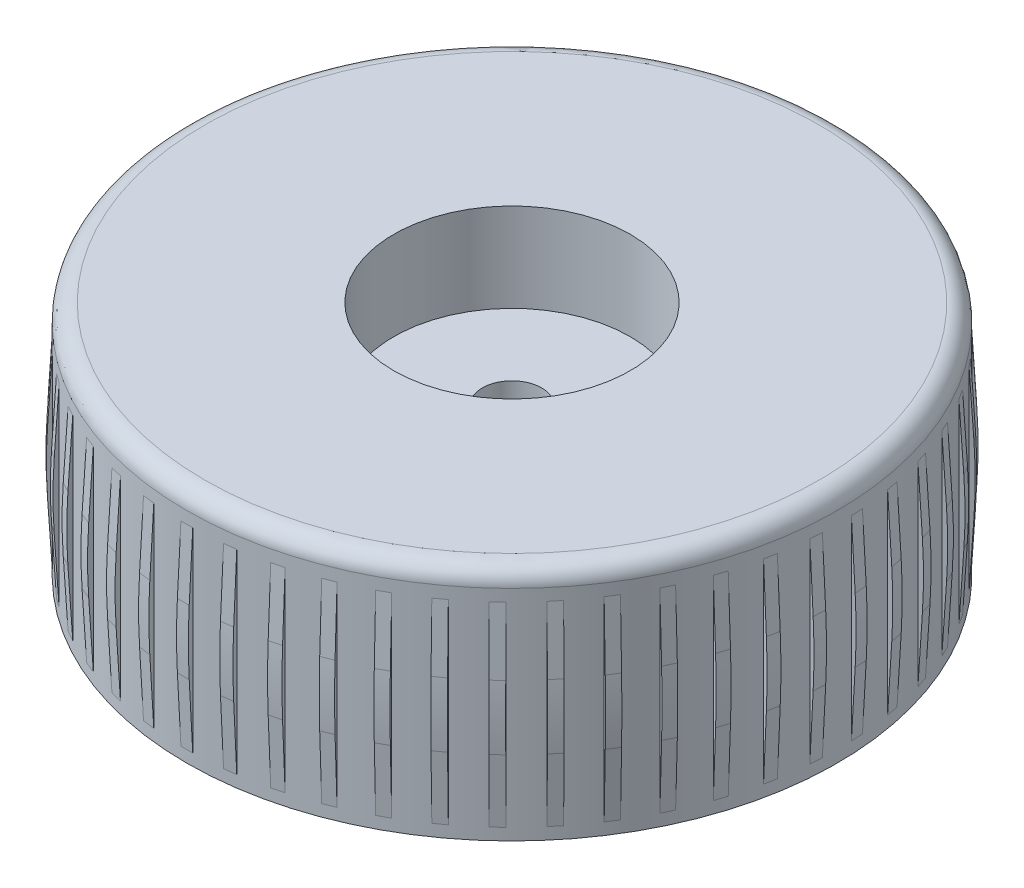
from build123d import *

# Parameters (mm, degrees)
SKETCH1_R                = 27.5
SKETCH1_R_2              = 2.5
BOSS_EXTRUDE1_DEPTH      = 20
CUT_EXTRUDE3_START       = -15
SKETCH5_R                = 22.225
CUT_EXTRUDE3_DEPTH       = 29.732139211
FILLET1_R                = 1.5
BOSS_EXTRUDE2_DEPTH      = 0.5
BOSS_EXTRUDE2_DEPTH_BACK = 0.5
FILLET2_R                = 50
CIRPATTERN3_COUNT        = 50
SKETCH6_R                = 10
CUT_EXTRUDE4_DEPTH       = 7.5


with BuildPart() as part:
    # Sketch1 → Boss-Extrude1 (new body)
    with BuildSketch(Plane(origin=(0, 0, 0), x_dir=(1, 0, 0), z_dir=(0, 1, 0))):
        Circle(SKETCH1_R)
        Circle(SKETCH1_R_2, mode=Mode.SUBTRACT)
    extrude(amount=BOSS_EXTRUDE1_DEPTH)

    # Sketch5 → Cut-Extrude3 (cut, through all)
    with BuildSketch(Plane(origin=(0, 20, 0), x_dir=(1, 0, 0), z_dir=(0, 1, 0)).offset(CUT_EXTRUDE3_START)):
        Circle(SKETCH5_R)
    extrude(amount=-CUT_EXTRUDE3_DEPTH, mode=Mode.SUBTRACT)

    # Fillet1
    fillet1_edges = [part.edges().sort_by_distance(p)[0] for p in [
        (-27.5, 20, 0),
    ]]
    fillet(fillet1_edges, radius=FILLET1_R)

    # Sketch6 → Cut-Extrude4 (cut)
    with BuildSketch(Plane(origin=(0, 20, 0), x_dir=(1, 0, 0), z_dir=(0, 1, 0))):
        Circle(SKETCH6_R)
    extrude(amount=-CUT_EXTRUDE4_DEPTH, mode=Mode.SUBTRACT)


with BuildPart() as body_2:
    # Sketch2 → Boss-Extrude2 (new, two sides: drawn at the far end of the back side and taken through both)
    with BuildSketch(Plane(origin=(0, 0, 0), x_dir=(0, 0, -1), z_dir=(1, 0, 0)).offset(-BOSS_EXTRUDE2_DEPTH_BACK)):
        Polygon((27.5, 17.5), (27.95, 9.25), (27.5, 1), align=None)
    extrude(amount=BOSS_EXTRUDE2_DEPTH + BOSS_EXTRUDE2_DEPTH_BACK)

    # Fillet2
    fillet2_edges = [body_2.edges().sort_by_distance(p)[0] for p in [
        (0, 9.25, -27.95),
    ]]
    fillet(fillet2_edges, radius=FILLET2_R)


with BuildPart() as cirpattern3_1:
    # CirPattern3: pattern copy
    add(body_2.part.rotate(Axis((0, 18.5, 0), (0, -1, 0)), 1 * 360 / CIRPATTERN3_COUNT))


with BuildPart() as cirpattern3_2:
    # CirPattern3: pattern copy
    add(body_2.part.rotate(Axis((0, 18.5, 0), (0, -1, 0)), 2 * 360 / CIRPATTERN3_COUNT))


with BuildPart() as cirpattern3_3:
    # CirPattern3: pattern copy
    add(body_2.part.rotate(Axis((0, 18.5, 0), (0, -1, 0)), 3 * 360 / CIRPATTERN3_COUNT))


with BuildPart() as cirpattern3_4:
    # CirPattern3: pattern copy
    add(body_2.part.rotate(Axis((0, 18.5, 0), (0, -1, 0)), 4 * 360 / CIRPATTERN3_COUNT))


with BuildPart() as cirpattern3_5:
    # CirPattern3: pattern copy
    add(body_2.part.rotate(Axis((0, 18.5, 0), (0, -1, 0)), 5 * 360 / CIRPATTERN3_COUNT))


with BuildPart() as cirpattern3_6:
    # CirPattern3: pattern copy
    add(body_2.part.rotate(Axis((0, 18.5, 0), (0, -1, 0)), 6 * 360 / CIRPATTERN3_COUNT))


with BuildPart() as cirpattern3_7:
    # CirPattern3: pattern copy
    add(body_2.part.rotate(Axis((0, 18.5, 0), (0, -1, 0)), 7 * 360 / CIRPATTERN3_COUNT))


with BuildPart() as cirpattern3_8:
    # CirPattern3: pattern copy
    add(body_2.part.rotate(Axis((0, 18.5, 0), (0, -1, 0)), 8 * 360 / CIRPATTERN3_COUNT))


with BuildPart() as cirpattern3_9:
    # CirPattern3: pattern copy
    add(body_2.part.rotate(Axis((0, 18.5, 0), (0, -1, 0)), 9 * 360 / CIRPATTERN3_COUNT))


with BuildPart() as cirpattern3_10:
    # CirPattern3: pattern copy
    add(body_2.part.rotate(Axis((0, 18.5, 0), (0, -1, 0)), 10 * 360 / CIRPATTERN3_COUNT))


with BuildPart() as cirpattern3_11:
    # CirPattern3: pattern copy
    add(body_2.part.rotate(Axis((0, 18.5, 0), (0, -1, 0)), 11 * 360 / CIRPATTERN3_COUNT))


with BuildPart() as cirpattern3_12:
    # CirPattern3: pattern copy
    add(body_2.part.rotate(Axis((0, 18.5, 0), (0, -1, 0)), 12 * 360 / CIRPATTERN3_COUNT))


with BuildPart() as cirpattern3_13:
    # CirPattern3: pattern copy
    add(body_2.part.rotate(Axis((0, 18.5, 0), (0, -1, 0)), 13 * 360 / CIRPATTERN3_COUNT))


with BuildPart() as cirpattern3_14:
    # CirPattern3: pattern copy
    add(body_2.part.rotate(Axis((0, 18.5, 0), (0, -1, 0)), 14 * 360 / CIRPATTERN3_COUNT))


with BuildPart() as cirpattern3_15:
    # CirPattern3: pattern copy
    add(body_2.part.rotate(Axis((0, 18.5, 0), (0, -1, 0)), 15 * 360 / CIRPATTERN3_COUNT))


with BuildPart() as cirpattern3_16:
    # CirPattern3: pattern copy
    add(body_2.part.rotate(Axis((0, 18.5, 0), (0, -1, 0)), 16 * 360 / CIRPATTERN3_COUNT))


with BuildPart() as cirpattern3_17:
    # CirPattern3: pattern copy
    add(body_2.part.rotate(Axis((0, 18.5, 0), (0, -1, 0)), 17 * 360 / CIRPATTERN3_COUNT))


with BuildPart() as cirpattern3_18:
    # CirPattern3: pattern copy
    add(body_2.part.rotate(Axis((0, 18.5, 0), (0, -1, 0)), 18 * 360 / CIRPATTERN3_COUNT))


with BuildPart() as cirpattern3_19:
    # CirPattern3: pattern copy
    add(body_2.part.rotate(Axis((0, 18.5, 0), (0, -1, 0)), 19 * 360 / CIRPATTERN3_COUNT))


with BuildPart() as cirpattern3_20:
    # CirPattern3: pattern copy
    add(body_2.part.rotate(Axis((0, 18.5, 0), (0, -1, 0)), 20 * 360 / CIRPATTERN3_COUNT))


with BuildPart() as cirpattern3_21:
    # CirPattern3: pattern copy
    add(body_2.part.rotate(Axis((0, 18.5, 0), (0, -1, 0)), 21 * 360 / CIRPATTERN3_COUNT))


with BuildPart() as cirpattern3_22:
    # CirPattern3: pattern copy
    add(body_2.part.rotate(Axis((0, 18.5, 0), (0, -1, 0)), 22 * 360 / CIRPATTERN3_COUNT))


with BuildPart() as cirpattern3_23:
    # CirPattern3: pattern copy
    add(body_2.part.rotate(Axis((0, 18.5, 0), (0, -1, 0)), 23 * 360 / CIRPATTERN3_COUNT))


with BuildPart() as cirpattern3_24:
    # CirPattern3: pattern copy
    add(body_2.part.rotate(Axis((0, 18.5, 0), (0, -1, 0)), 24 * 360 / CIRPATTERN3_COUNT))


with BuildPart() as cirpattern3_25:
    # CirPattern3: pattern copy
    add(body_2.part.rotate(Axis((0, 18.5, 0), (0, -1, 0)), 25 * 360 / CIRPATTERN3_COUNT))


with BuildPart() as cirpattern3_26:
    # CirPattern3: pattern copy
    add(body_2.part.rotate(Axis((0, 18.5, 0), (0, -1, 0)), 26 * 360 / CIRPATTERN3_COUNT))


with BuildPart() as cirpattern3_27:
    # CirPattern3: pattern copy
    add(body_2.part.rotate(Axis((0, 18.5, 0), (0, -1, 0)), 27 * 360 / CIRPATTERN3_COUNT))


with BuildPart() as cirpattern3_28:
    # CirPattern3: pattern copy
    add(body_2.part.rotate(Axis((0, 18.5, 0), (0, -1, 0)), 28 * 360 / CIRPATTERN3_COUNT))


with BuildPart() as cirpattern3_29:
    # CirPattern3: pattern copy
    add(body_2.part.rotate(Axis((0, 18.5, 0), (0, -1, 0)), 29 * 360 / CIRPATTERN3_COUNT))


with BuildPart() as cirpattern3_30:
    # CirPattern3: pattern copy
    add(body_2.part.rotate(Axis((0, 18.5, 0), (0, -1, 0)), 30 * 360 / CIRPATTERN3_COUNT))


with BuildPart() as cirpattern3_31:
    # CirPattern3: pattern copy
    add(body_2.part.rotate(Axis((0, 18.5, 0), (0, -1, 0)), 31 * 360 / CIRPATTERN3_COUNT))


with BuildPart() as cirpattern3_32:
    # CirPattern3: pattern copy
    add(body_2.part.rotate(Axis((0, 18.5, 0), (0, -1, 0)), 32 * 360 / CIRPATTERN3_COUNT))


with BuildPart() as cirpattern3_33:
    # CirPattern3: pattern copy
    add(body_2.part.rotate(Axis((0, 18.5, 0), (0, -1, 0)), 33 * 360 / CIRPATTERN3_COUNT))


with BuildPart() as cirpattern3_34:
    # CirPattern3: pattern copy
    add(body_2.part.rotate(Axis((0, 18.5, 0), (0, -1, 0)), 34 * 360 / CIRPATTERN3_COUNT))


with BuildPart() as cirpattern3_35:
    # CirPattern3: pattern copy
    add(body_2.part.rotate(Axis((0, 18.5, 0), (0, -1, 0)), 35 * 360 / CIRPATTERN3_COUNT))


with BuildPart() as cirpattern3_36:
    # CirPattern3: pattern copy
    add(body_2.part.rotate(Axis((0, 18.5, 0), (0, -1, 0)), 36 * 360 / CIRPATTERN3_COUNT))


with BuildPart() as cirpattern3_37:
    # CirPattern3: pattern copy
    add(body_2.part.rotate(Axis((0, 18.5, 0), (0, -1, 0)), 37 * 360 / CIRPATTERN3_COUNT))


with BuildPart() as cirpattern3_38:
    # CirPattern3: pattern copy
    add(body_2.part.rotate(Axis((0, 18.5, 0), (0, -1, 0)), 38 * 360 / CIRPATTERN3_COUNT))


with BuildPart() as cirpattern3_39:
    # CirPattern3: pattern copy
    add(body_2.part.rotate(Axis((0, 18.5, 0), (0, -1, 0)), 39 * 360 / CIRPATTERN3_COUNT))


with BuildPart() as cirpattern3_40:
    # CirPattern3: pattern copy
    add(body_2.part.rotate(Axis((0, 18.5, 0), (0, -1, 0)), 40 * 360 / CIRPATTERN3_COUNT))


with BuildPart() as cirpattern3_41:
    # CirPattern3: pattern copy
    add(body_2.part.rotate(Axis((0, 18.5, 0), (0, -1, 0)), 41 * 360 / CIRPATTERN3_COUNT))


with BuildPart() as cirpattern3_42:
    # CirPattern3: pattern copy
    add(body_2.part.rotate(Axis((0, 18.5, 0), (0, -1, 0)), 42 * 360 / CIRPATTERN3_COUNT))


with BuildPart() as cirpattern3_43:
    # CirPattern3: pattern copy
    add(body_2.part.rotate(Axis((0, 18.5, 0), (0, -1, 0)), 43 * 360 / CIRPATTERN3_COUNT))


with BuildPart() as cirpattern3_44:
    # CirPattern3: pattern copy
    add(body_2.part.rotate(Axis((0, 18.5, 0), (0, -1, 0)), 44 * 360 / CIRPATTERN3_COUNT))


with BuildPart() as cirpattern3_45:
    # CirPattern3: pattern copy
    add(body_2.part.rotate(Axis((0, 18.5, 0), (0, -1, 0)), 45 * 360 / CIRPATTERN3_COUNT))


with BuildPart() as cirpattern3_46:
    # CirPattern3: pattern copy
    add(body_2.part.rotate(Axis((0, 18.5, 0), (0, -1, 0)), 46 * 360 / CIRPATTERN3_COUNT))


with BuildPart() as cirpattern3_47:
    # CirPattern3: pattern copy
    add(body_2.part.rotate(Axis((0, 18.5, 0), (0, -1, 0)), 47 * 360 / CIRPATTERN3_COUNT))


with BuildPart() as cirpattern3_48:
    # CirPattern3: pattern copy
    add(body_2.part.rotate(Axis((0, 18.5, 0), (0, -1, 0)), 48 * 360 / CIRPATTERN3_COUNT))


with BuildPart() as cirpattern3_49:
    # CirPattern3: pattern copy
    add(body_2.part.rotate(Axis((0, 18.5, 0), (0, -1, 0)), 49 * 360 / CIRPATTERN3_COUNT))


solid = Compound([part.part, body_2.part, cirpattern3_1.part, cirpattern3_2.part, cirpattern3_3.part, cirpattern3_4.part, cirpattern3_5.part, cirpattern3_6.part, cirpattern3_7.part, cirpattern3_8.part, cirpattern3_9.part, cirpattern3_10.part, cirpattern3_11.part, cirpattern3_12.part, cirpattern3_13.part, cirpattern3_14.part, cirpattern3_15.part, cirpattern3_16.part, cirpattern3_17.part, cirpattern3_18.part, cirpattern3_19.part, cirpattern3_20.part, cirpattern3_21.part, cirpattern3_22.part, cirpattern3_23.part, cirpattern3_24.part, cirpattern3_25.part, cirpattern3_26.part, cirpattern3_27.part, cirpattern3_28.part, cirpattern3_29.part, cirpattern3_30.part, cirpattern3_31.part, cirpattern3_32.part, cirpattern3_33.part, cirpattern3_34.part, cirpattern3_35.part, cirpattern3_36.part, cirpattern3_37.part, cirpattern3_38.part, cirpattern3_39.part, cirpattern3_40.part, cirpattern3_41.part, cirpattern3_42.part, cirpattern3_43.part, cirpattern3_44.part, cirpattern3_45.part, cirpattern3_46.part, cirpattern3_47.part, cirpattern3_48.part, cirpattern3_49.part])
